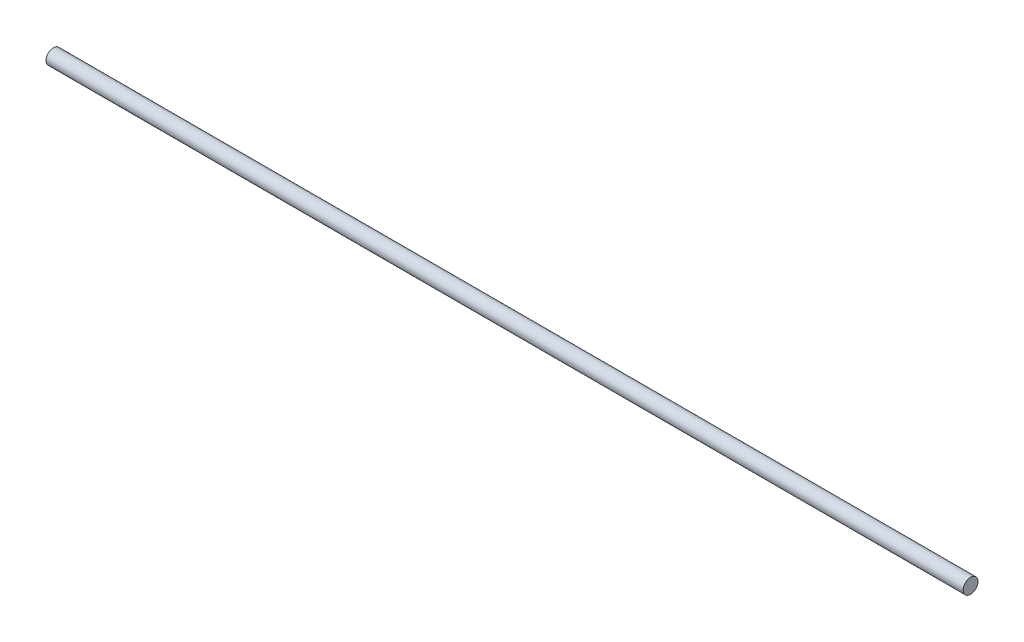
from build123d import *

# Parameters (mm, degrees)
SKETCH1_R           = 3.175
BOSS_EXTRUDE1_DEPTH = 393.7


with BuildPart() as part:
    # Sketch1 → Boss-Extrude1 (new body)
    with BuildSketch(Plane(origin=(0, 0, 0), x_dir=(0, 0, -1), z_dir=(1, 0, 0))):
        Circle(SKETCH1_R)
    extrude(amount=BOSS_EXTRUDE1_DEPTH)


solid = part.part
